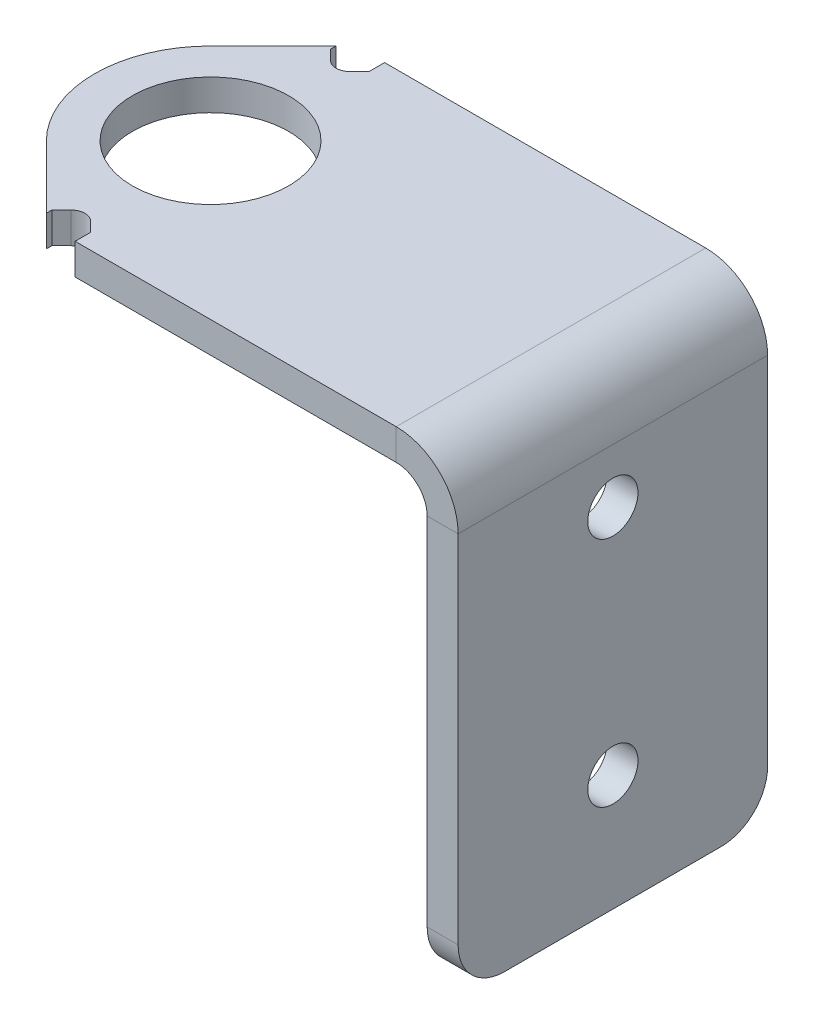
from build123d import *

# Parameters (mm, degrees)
BOSS_EXTRUDE1_DEPTH        = 2
M3_CLEARANCE_HOLE1_D       = 3.242
HOLE1_D                    = 10.1
SKETCHED_START             = 62.517190459
SKETCHED_BEND1_OUTLINE_W   = 2
SKETCHED_BEND1_OUTLINE_H   = 20.000000002
SKETCHED_BEND1_DEPTH       = 31.482809541
SKETCHED_START_2           = 60.939670459
SKETCHED_BEND1_2_OUTLINE_R = 5.05
SKETCHED_BEND1_2_DEPTH     = 0.021621314
SKETCHED_START_3           = 58.939670459
SKETCHED_BEND1_3_OUTLINE_R = 5.05
SKETCHED_BEND1_3_DEPTH     = 4
SKETCHED_START_4           = -10.000000001
SKETCHED_BEND1_4_DEPTH     = 20.000000002
CUT_EXTRUDE1_REACH         = 45.464


with BuildPart() as part:
    # Sketch5 → Boss-Extrude1 (new body)
    with BuildSketch(Plane(origin=(1.681750162, 0, 0), x_dir=(0, -1, 0), z_dir=(-1, 0, 0))):
        with BuildLine():
            Line((-35.93967046, 10.000000001), (-86.258661155, 10.000000001))
            Line((-86.258661155, 10.000000001), (-90.955360298, 5.303300858))
            ThreePointArc((-90.955360298, 5.303300858), (-93.152059438, 0), (-90.955360298, -5.303300858))
            Line((-90.955360298, -5.303300858), (-86.258661155, -10.000000001))
            Line((-86.258661155, -10.000000001), (-35.93967046, -10.000000001))
            ThreePointArc((-35.93967046, -10.000000001), (-33.818350116, -9.121320344), (-32.93967046, -7.000000001))
            Line((-32.93967046, -7.000000001), (-32.93967046, 7.000000001))
            ThreePointArc((-32.93967046, 7.000000001), (-33.818350116, 9.121320344), (-35.93967046, 10.000000001))
        make_face()
    extrude(amount=-BOSS_EXTRUDE1_DEPTH)

    # M3 Clearance Hole1 (through all)
    with Locations(Plane(origin=(3.681750162, 0, 0), x_dir=(0, 0, -1), z_dir=(1, 0, 0))):
        with Locations((0, 40.439670459), (0, 55.439670459)):
            Hole(M3_CLEARANCE_HOLE1_D / 2)

    # Hole1 (through all)
    with Locations(Plane.ZY.offset(-1.681750162)):
        with Locations((0, 85.65205944)):
            Hole(HOLE1_D / 2)

    # Sketched Bend1: read off the stored shape, not the designer's step
    # Sketched Bend1 outline → Sketched Bend1 (cut)
    with BuildSketch(Plane(origin=(0, 0, 0), x_dir=(1, 0, 0), z_dir=(0, 1, 0)).offset(SKETCHED_START)):
        with Locations((2.681750162, 0)):
            Rectangle(SKETCHED_BEND1_OUTLINE_W, SKETCHED_BEND1_OUTLINE_H)
    extrude(amount=SKETCHED_BEND1_DEPTH, mode=Mode.SUBTRACT)

    # Sketched Bend1 2 outline → Sketched Bend1 2 (add)
    with BuildSketch(Plane(origin=(0, 0, 0), x_dir=(1, 0, 0), z_dir=(0, 1, 0)).offset(SKETCHED_START_2)):
        with BuildLine():
            Line((1.681750162, 10.000000001), (-22.924851553, 10.000000001))
            Line((-22.924851553, 10.000000001), (-27.621550696, 5.303300858))
            ThreePointArc((-27.621550696, 5.303300858), (-29.818249837, 0), (-27.621550696, -5.303300858))
            Line((-27.621550696, -5.303300858), (-22.924851553, -10.000000001))
            Line((-22.924851553, -10.000000001), (1.681750162, -10.000000001))
            Line((1.681750162, -10.000000001), (1.681750162, 10.000000001))
        make_face()
        with Locations((-22.318249838, 0)):
            Circle(SKETCHED_BEND1_2_OUTLINE_R, mode=Mode.SUBTRACT)
    extrude(amount=SKETCHED_BEND1_2_DEPTH)

    # Sketched Bend1 3 outline → Sketched Bend1 3 (add)
    with BuildSketch(Plane(origin=(0, 0, 0), x_dir=(1, 0, 0), z_dir=(0, 1, 0)).offset(SKETCHED_START_3)):
        with BuildLine():
            Line((1.681750162, 10.000000001), (-22.924851553, 10.000000001))
            Line((-22.924851553, 10.000000001), (-27.621550696, 5.303300858))
            ThreePointArc((-27.621550696, 5.303300858), (-29.818249837, 0), (-27.621550696, -5.303300858))
            Line((-27.621550696, -5.303300858), (-22.924851553, -10.000000001))
            Line((-22.924851553, -10.000000001), (1.681750162, -10.000000001))
            Line((1.681750162, -10.000000001), (1.681750162, 10.000000001))
        make_face()
        with Locations((-22.318249838, 0)):
            Circle(SKETCHED_BEND1_3_OUTLINE_R, mode=Mode.SUBTRACT)
    extrude(amount=SKETCHED_BEND1_3_DEPTH)

    # Sketched Bend1 4 outline → Sketched Bend1 4 (cut)
    with BuildSketch(Plane.XY.offset(SKETCHED_START_4)):
        with BuildLine():
            Line((-0.318249838, 60.939670459), (-31, 60.939670459))
            Line((-31, 60.939670459), (-31, 58.939670459))
            Line((-31, 58.939670459), (1.681750162, 58.939670459))
            ThreePointArc((1.681750162, 58.939670459), (1.095963724, 60.353884021), (-0.318249838, 60.939670459))
        make_face()
        with BuildLine():
            Line((-31, 64), (-31, 62.939670452))
            Line((-31, 62.939670452), (-0.318249838, 62.939670459))
            ThreePointArc((-0.318249838, 62.939670459), (2.510177287, 61.768097584), (3.681750162, 58.939670459))
            Line((3.681750162, 58.939670459), (3.681750162, 62.517190459))
            Line((3.681750162, 62.517190459), (1.681750162, 62.517190459))
            Line((1.681750162, 62.517190459), (1.681750162, 64))
            Line((1.681750162, 64), (-31, 64))
        make_face()
    extrude(amount=SKETCHED_BEND1_4_DEPTH, mode=Mode.SUBTRACT)

    # Sketch15 → Cut-Extrude1 (cut, up to next)
    with BuildSketch(Plane(origin=(0, 62.939670459, 0), x_dir=(1, 0, 0), z_dir=(0, 1, 0)), mode=Mode.PRIVATE) as cut_extrude1_sk1:
        with BuildLine():
            Line((-21.068249838, 9.000000001), (-21.068249838, 10.000000001))
            Line((-21.068249838, 10.000000001), (-22.924851553, 10.000000001))
            Line((-22.924851553, 10.000000001), (-23.568249838, 9.356601716))
            Line((-23.568249838, 9.356601716), (-23.568249838, 9.000000001))
            Line((-23.568249838, 9.000000001), (-22.943249838, 8.375000001))
            ThreePointArc((-22.943249838, 8.375000001), (-22.318249838, 8.116116524), (-21.693249838, 8.375000001))
            Line((-21.693249838, 8.375000001), (-21.068249838, 9.000000001))
        make_face()
    cut_extrude1_tool1 = extrude(cut_extrude1_sk1.sketch, amount=-CUT_EXTRUDE1_REACH, mode=Mode.PRIVATE) & part.part
    # Sketch15 → Cut-Extrude1 (cut, up to next)
    with BuildSketch(Plane(origin=(0, 62.939670459, 0), x_dir=(1, 0, 0), z_dir=(0, 1, 0)), mode=Mode.PRIVATE) as cut_extrude1_sk2:
        with BuildLine():
            Line((-21.068249838, -9.000000001), (-21.693249838, -8.375000001))
            ThreePointArc((-21.693249838, -8.375000001), (-22.318249838, -8.116116524), (-22.943249838, -8.375000001))
            Line((-22.943249838, -8.375000001), (-23.568249838, -9.000000001))
            Line((-23.568249838, -9.000000001), (-23.568249838, -9.356601716))
            Line((-23.568249838, -9.356601716), (-22.924851553, -10.000000001))
            Line((-22.924851553, -10.000000001), (-21.068249838, -10.000000001))
            Line((-21.068249838, -10.000000001), (-21.068249838, -9.000000001))
        make_face()
    cut_extrude1_tool2 = extrude(cut_extrude1_sk2.sketch, amount=-CUT_EXTRUDE1_REACH, mode=Mode.PRIVATE) & part.part
    add(cut_extrude1_tool1.solids().sort_by_distance((-22.260131, 62.93967, -9.16246))[0], mode=Mode.SUBTRACT)
    add(cut_extrude1_tool2.solids().sort_by_distance((-22.260131, 62.93967, 9.16246))[0], mode=Mode.SUBTRACT)


solid = part.part
